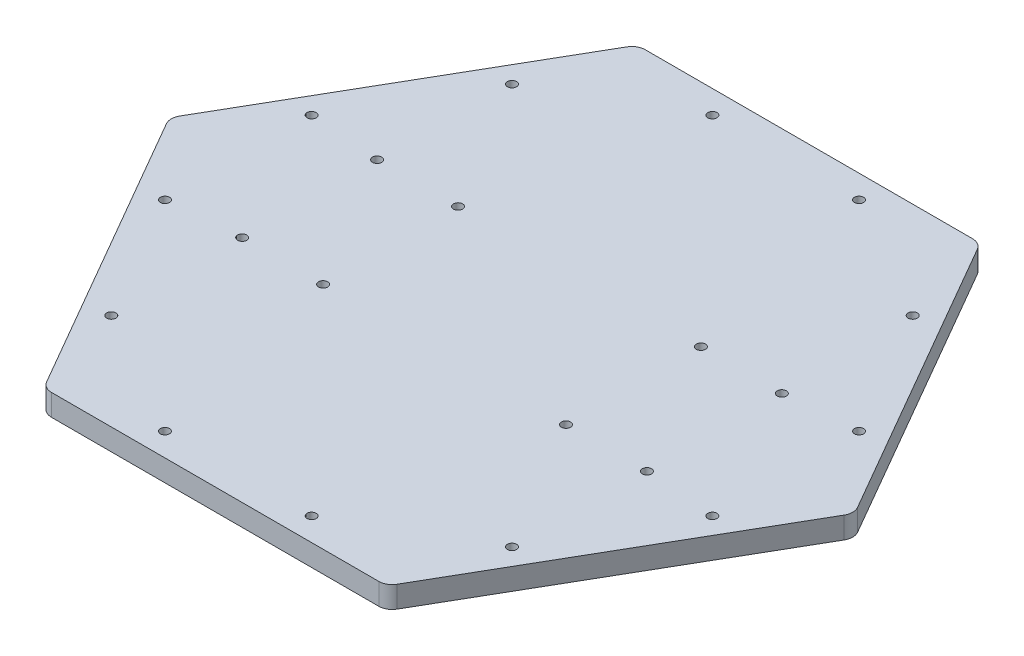
from build123d import *

# Parameters (mm, degrees)
SKETCH1_R          = 1.7
BASE_FLANGE1_DEPTH = 8
FILLET2_R          = 5


# Sheet-metal steps are written as plain solids
with BuildPart() as part:
    # Sketch1 → Base-Flange1 (new body)
    with BuildSketch(Plane(origin=(0, 0, 0), x_dir=(1, 0, 0), z_dir=(0, 1, 0))):
        Polygon((127.017059222, 0), (63.508529611, 110), (-63.508529611, 110), (-127.017059222, 0), (-63.508529611, -110), (63.508529611, -110), align=None)
        with Locations(Location((-75, 25, 0), (0, 0, 270))):
            Circle(SKETCH1_R, mode=Mode.SUBTRACT)
        with Locations(Location((-75, -25, 0), (0, 0, 270))):
            Circle(SKETCH1_R, mode=Mode.SUBTRACT)
        with Locations(Location((75, 25, 0), (0, 0, 270))):
            Circle(SKETCH1_R, mode=Mode.SUBTRACT)
        with Locations(Location((75, -25, 0), (0, 0, 270))):
            Circle(SKETCH1_R, mode=Mode.SUBTRACT)
        with Locations(Location((-45, 25, 0), (0, 0, 270))):
            Circle(SKETCH1_R, mode=Mode.SUBTRACT)
        with Locations(Location((-45, -25, 0), (0, 0, 270))):
            Circle(SKETCH1_R, mode=Mode.SUBTRACT)
        with Locations(Location((45, 25, 0), (0, 0, 270))):
            Circle(SKETCH1_R, mode=Mode.SUBTRACT)
        with Locations(Location((45, -25, 0), (0, 0, 270))):
            Circle(SKETCH1_R, mode=Mode.SUBTRACT)
        with Locations(Location((-74.246212025, -74.246212025, 0), (0, 0, 270))):
            Circle(SKETCH1_R, mode=Mode.SUBTRACT)
        with Locations(Location((-101.42221176, -27.175999736, 0), (0, 0, 270))):
            Circle(SKETCH1_R, mode=Mode.SUBTRACT)
        with Locations(Location((-101.42221176, 27.175999736, 0), (0, 0, 270))):
            Circle(SKETCH1_R, mode=Mode.SUBTRACT)
        with Locations(Location((-74.246212025, 74.246212025, 0), (0, 0, 270))):
            Circle(SKETCH1_R, mode=Mode.SUBTRACT)
        with Locations(Location((-27.175999736, 101.42221176, 0), (0, 0, 270))):
            Circle(SKETCH1_R, mode=Mode.SUBTRACT)
        with Locations(Location((27.175999736, 101.42221176, 0), (0, 0, 270))):
            Circle(SKETCH1_R, mode=Mode.SUBTRACT)
        with Locations(Location((74.246212025, 74.246212025, 0), (0, 0, 270))):
            Circle(SKETCH1_R, mode=Mode.SUBTRACT)
        with Locations(Location((101.42221176, 27.175999736, 0), (0, 0, 270))):
            Circle(SKETCH1_R, mode=Mode.SUBTRACT)
        with Locations(Location((101.42221176, -27.175999736, 0), (0, 0, 270))):
            Circle(SKETCH1_R, mode=Mode.SUBTRACT)
        with Locations(Location((74.246212025, -74.246212025, 0), (0, 0, 270))):
            Circle(SKETCH1_R, mode=Mode.SUBTRACT)
        with Locations(Location((27.175999736, -101.42221176, 0), (0, 0, 270))):
            Circle(SKETCH1_R, mode=Mode.SUBTRACT)
        with Locations(Location((-27.175999736, -101.42221176, 0), (0, 0, 270))):
            Circle(SKETCH1_R, mode=Mode.SUBTRACT)
    extrude(amount=-BASE_FLANGE1_DEPTH)

    # Fillet2
    fillet2_edges = [part.edges().sort_by_distance(p)[0] for p in [
        (63.508529611, -4, 110),
        (-63.508529611, -4, 110),
        (-127.017059222, -4, 0),
        (-63.508529611, -4, -110),
        (63.508529611, -4, -110),
        (127.017059222, -4, 0),
    ]]
    fillet(fillet2_edges, radius=FILLET2_R)


solid = part.part
